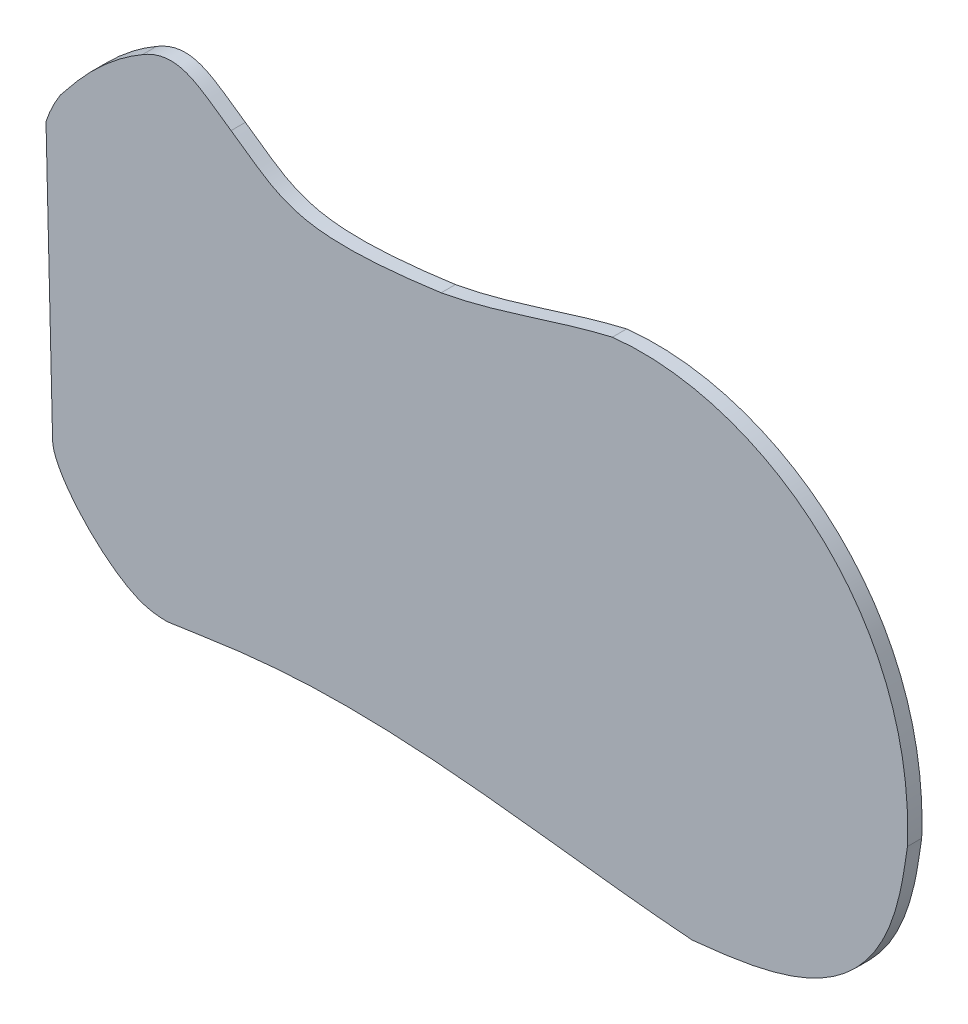
from build123d import *

# Parameters (mm, degrees)
BOSS_EXTRUDE4_DEPTH = 3
SCALE1_SCALE        = 0.86


# Read off the part's stored shape, not the designer's step: Boss-Extrude4
with BuildPart() as part:
    # Boss-Extrude4 outline → Boss-Extrude4 (new body)
    with BuildSketch(Plane.XY):
        with BuildLine():
            add(Edge.make_bspline(
                [(128.82833309, 105.536623813), (159.315788443, 109.006350456), (192.475992382, 86.212295483), (190.794375589, 43.885867645)],
                knots=[0, 0, 0, 0, 1, 1, 1, 1], degree=3))
            add(Edge.make_bspline(
                [(92.87165983, 95.629562044), (105.148722359, 97.866221646), (116.705848504, 102.706993295), (128.82833309, 105.536623813)],
                knots=[0, 0, 0, 0, 1, 1, 1, 1], degree=3))
            add(Edge.make_bspline(
                [(92.87165983, 95.629562044), (78.874553109, 93.684568119), (61.0348089, 92.108576277), (59.272608111, 95.97566045), (41.403108896, 108.020274617), (38.175658748, 111.707809956), (32.53925388, 109.060669967), (30.113522357, 107.565046253)],
                knots=[0, 0, 0, 0, 0, 1, 1, 1, 1.698662339, 1.698662339, 1.698662339, 1.698662339, 1.698662339], degree=4))
            add(Edge.make_bspline(
                [(12.914792947, 91.625113761), (16.949837177, 96.750446573), (22.113989283, 102.883143014), (30.113522357, 107.565046253)],
                knots=[0, 0, 0, 0, 1, 1, 1, 1], degree=3))
            add(Edge.make_bspline(
                [(9.886852416, 85.293194855), (10.97741097, 88.595155789), (12.914792947, 91.625113761)],
                knots=[0, 0, 0, 1, 1, 1], degree=2))
            Line((9.886852416, 85.293194855), (11.271471488, 28.088427646))
            add(Edge.make_bspline(
                [(11.271471488, 28.088427646), (11.271471488, 20.815583109), (26.686574013, 6.45868902), (30.71485135, 7.312076366), (35.266090121, 7.033710678)],
                knots=[0, 0, 0, 0, 0, 1, 1, 1, 1, 1], degree=4))
            add(Edge.make_bspline(
                [(35.266090121, 7.033710678), (48.561112758, 8.632251116), (75.101234368, 15.586721231), (109.214272404, 6.953370257), (145.540382928, 4.267266007)],
                knots=[0, 0, 0, 0, 0, 1, 1, 1, 1, 1], degree=4))
            ThreePointArc((145.540382928, 4.267266007), (145.619959196, 4.264912487), (145.69943212, 4.269600342))
            add(Edge.make_bspline(
                [(145.69943212, 4.269600342), (166.885614368, 6.462982074), (187.913311107, 9.653551401), (189.301900074, 35.0267482), (190.794375589, 43.885867645)],
                knots=[0, 0, 0, 0, 0, 1, 1, 1, 1, 1], degree=4))
        make_face()
    extrude(amount=BOSS_EXTRUDE4_DEPTH)


with BuildPart() as part_1:
    # Scale1: scaled about (98.605522213, 54.325229802, 1.5)
    add(part.part.scale(SCALE1_SCALE).moved(Location((13.80477311, 7.605532172, 0.21))))


solid = part_1.part
